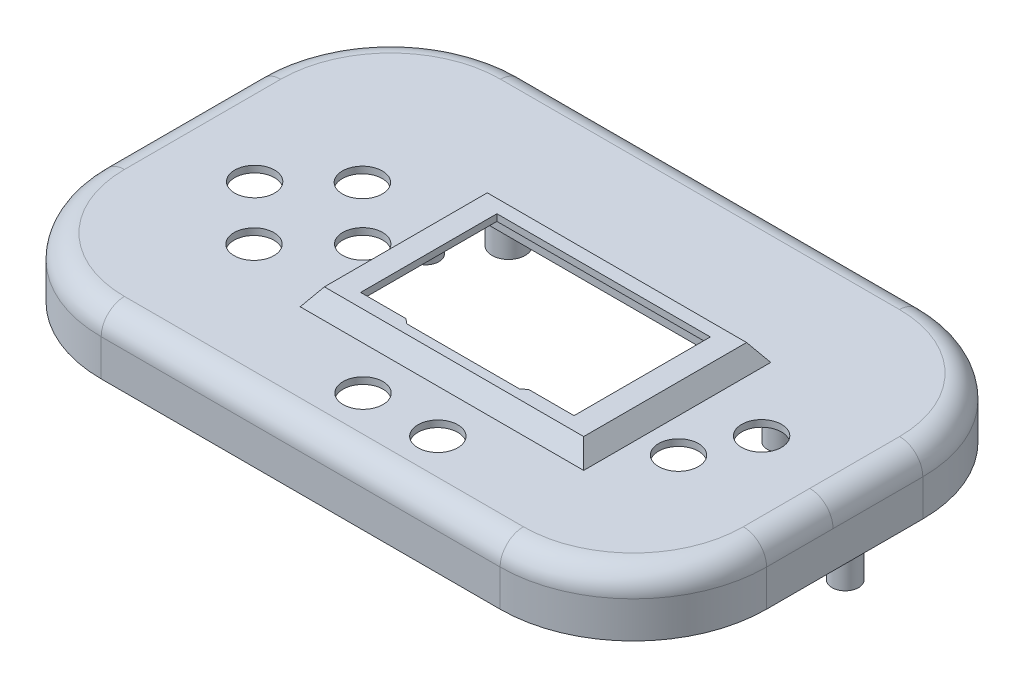
from build123d import *

# Parameters (mm, degrees)
SKETCH1_W           = 160
SKETCH1_H           = 117
BOSS_EXTRUDE1_DEPTH = 2
SKETCH3_R           = 6
CUT_EXTRUDE1_DEPTH  = 100.127443223
SKETCH4_R           = 6
CUT_EXTRUDE3_DEPTH  = 100.127443223
SKETCH5_R           = 6
CUT_EXTRUDE4_DEPTH  = 100.127443223
SKETCH6_W           = 76.000007526
SKETCH6_H           = 46.999987397
SKETCH6_W_2         = 72.000007526
SKETCH6_H_2         = 42.999987397
CUT_EXTRUDE5_DEPTH  = 10
SKETCH7_R           = 4
SKETCH7_R_2         = 1.25
BOSS_EXTRUDE2_DEPTH = 7.81
SKETCH8_W           = 78.000007526
SKETCH8_H           = 48.999987397
SKETCH8_W_2         = 76.000007526
SKETCH8_H_2         = 46.999987397
BOSS_EXTRUDE3_DEPTH = 5.19
SKETCH9_W           = 76.000007526
SKETCH9_H           = 46.999987397
BOSS_EXTRUDE4_DEPTH = 2
DRAFT2_ANGLE        = 35
SKETCH12_W          = 160
SKETCH12_H          = 14.938358446
SKETCH12_W_2        = 31.199462864
SKETCH12_H_2        = 9.099678356
SKETCH12_W_3        = 31.607152295
SKETCH12_H_3        = 7.36210802
CUT_EXTRUDE7_DEPTH  = 10
SKETCH13_R          = 6
CUT_EXTRUDE8_DEPTH  = 10
SKETCH14_W          = 120
SKETCH14_H          = 2
SKETCH14_W_2        = 2
SKETCH14_H_2        = 47
SKETCH14_H_3        = 27
SKETCH14_H_4        = 20
BOSS_EXTRUDE5_DEPTH = 8
SKETCH15_R          = 5
SKETCH15_R_2        = 4
BOSS_EXTRUDE6_DEPTH = 33.22
CHAMFER1_SIZE       = 5
SKETCH16_R          = 1.25
CUT_EXTRUDE9_DEPTH  = 10


with BuildPart() as part:
    # Sketch1 → Boss-Extrude1 (new body)
    with BuildSketch(Plane(origin=(0, 0, 0), x_dir=(1, 0, 0), z_dir=(0, 1, 0))):
        Rectangle(SKETCH1_W, SKETCH1_H)
    extrude(amount=BOSS_EXTRUDE1_DEPTH)

    # Sketch3 → Cut-Extrude1 (cut, through all)
    with BuildSketch(Plane(origin=(0, 2, 0), x_dir=(1, 0, 0), z_dir=(0, 1, 0))):
        with Locations(Location((72.15303621, -2.066282122, 0), (0, 0, 270))):
            Circle(SKETCH3_R)
    extrude(amount=-CUT_EXTRUDE1_DEPTH, mode=Mode.SUBTRACT)

    # Sketch4 → Cut-Extrude3 (cut, through all)
    with BuildSketch(Plane(origin=(0, 2, 0), x_dir=(1, 0, 0), z_dir=(0, 1, 0))):
        with Locations(Location((23.553035896, -50.866150132, 0), (0, 0, 270))):
            Circle(SKETCH4_R)
    extrude(amount=-CUT_EXTRUDE3_DEPTH, mode=Mode.SUBTRACT)

    # Sketch5 → Cut-Extrude4 (cut, through all)
    with BuildSketch(Plane(origin=(0, 2, 0), x_dir=(1, 0, 0), z_dir=(0, 1, 0))):
        with Locations(Location((64.653036213, -19.566282124, 0), (0, 0, 270))):
            Circle(SKETCH5_R)
        with Locations(Location((-37.846967603, -12.066282143, 0), (0, 0, 270))):
            Circle(SKETCH5_R)
        with Locations(Location((1.053035896, -50.866150137, 0), (0, 0, 270))):
            Circle(SKETCH5_R)
        with Locations(Location((-53.91492316, 3.900994062, 0), (0, 0, 270))):
            Circle(SKETCH5_R)
        with Locations(Location((-70.34696951, -12.066282149, 0), (0, 0, 270))):
            Circle(SKETCH5_R)
        with Locations(Location((-54.14683932, -28.466289977, 0), (0, 0, 270))):
            Circle(SKETCH5_R)
    extrude(amount=-CUT_EXTRUDE4_DEPTH, mode=Mode.SUBTRACT)

    # Sketch6 → Cut-Extrude5 (cut)
    with BuildSketch(Plane(origin=(0, 2, 0), x_dir=(1, 0, 0), z_dir=(0, 1, 0))):
        with Locations((11.764130909, -9.702217308)):
            Rectangle(SKETCH6_W, SKETCH6_H)
        with Locations((11.764130909, -9.702217308)):
            Rectangle(SKETCH6_W_2, SKETCH6_H_2, mode=Mode.SUBTRACT)
    extrude(amount=-CUT_EXTRUDE5_DEPTH, mode=Mode.SUBTRACT)


with BuildPart() as cut_extrude5_kept_piece:
    # of the separate pieces the step leaves, the one the design keeps (cut_extrude5_pieces_kept)
    add(part.part.solids().sort_by_distance((80, 0, 58.5))[0])

    # Sketch7 → Boss-Extrude2 (add)
    # profile 1 of 5: a face of its own
    with BuildSketch(Plane.XZ):
        with Locations(Location((66.701777656, -9.076203809, 0), (0, 0, 90))):
            Circle(SKETCH7_R)
        with Locations(Location((66.701777656, -9.076203809, 0), (0, 0, 270))):
            Circle(SKETCH7_R_2, mode=Mode.SUBTRACT)
    # profile 2 of 5: a face of its own
    with BuildSketch(Plane.XZ):
        with Locations(Location((63.702108967, 46.190679909, 0), (0, 0, 90))):
            Circle(SKETCH7_R)
        with Locations(Location((63.702108967, 46.190679909, 0), (0, 0, 270))):
            Circle(SKETCH7_R_2, mode=Mode.SUBTRACT)
    # profile 3 of 5: a face of its own
    with BuildSketch(Plane.XZ):
        with Locations(Location((-31.54560253, 48.927228564, 0), (0, 0, 90))):
            Circle(SKETCH7_R)
        with Locations(Location((-31.54560253, 48.927228564, 0), (0, 0, 270))):
            Circle(SKETCH7_R_2, mode=Mode.SUBTRACT)
    # profile 4 of 5: a face of its own
    with BuildSketch(Plane.XZ):
        with Locations(Location((-70.794006102, 29.915173129, 0), (0, 0, 90))):
            Circle(SKETCH7_R)
        with Locations(Location((-70.794006102, 29.915173129, 0), (0, 0, 270))):
            Circle(SKETCH7_R_2, mode=Mode.SUBTRACT)
    # profile 5 of 5: a face of its own
    with BuildSketch(Plane.XZ):
        with Locations(Location((-35.552994644, -4.584596423, 0), (0, 0, 90))):
            Circle(SKETCH7_R)
        with Locations(Location((-35.552994644, -4.584596423, 0), (0, 0, 270))):
            Circle(SKETCH7_R_2, mode=Mode.SUBTRACT)
    extrude(amount=BOSS_EXTRUDE2_DEPTH)

    # Sketch8 → Boss-Extrude3 (add)
    with BuildSketch(Plane(origin=(0, 2, 0), x_dir=(1, 0, 0), z_dir=(0, 1, 0))):
        with Locations((11.764130909, -9.702217308)):
            Rectangle(SKETCH8_W, SKETCH8_H)
        with Locations((11.764130909, -9.702217308)):
            Rectangle(SKETCH8_W_2, SKETCH8_H_2, mode=Mode.SUBTRACT)
    extrude(amount=BOSS_EXTRUDE3_DEPTH)

    # Sketch9 → Boss-Extrude4 (add)
    with BuildSketch(Plane(origin=(0, 7.19, 0), x_dir=(1, 0, 0), z_dir=(0, 1, 0))):
        with Locations((11.764130909, -9.702217308)):
            Rectangle(SKETCH9_W, SKETCH9_H)
        Polygon((-5.195084148, -31.43953726), (-6.695094805, -30.202211996), (-20.335872635, -30.202211996), (-20.335872635, 10.797777117), (43.864134191, 10.797777117), (43.864134191, -30.202211996), (30.223355703, -30.202211996), (28.723346116, -31.43953726), align=None, mode=Mode.SUBTRACT)
    extrude(amount=-BOSS_EXTRUDE4_DEPTH)

    # Draft2
    draft2_faces = [cut_extrude5_kept_piece.faces().sort_by_distance(p)[0] for p in [
        (11.764130909, 4.595, -14.79777639),
        (-27.235872854, 4.595, 9.702217309),
        (11.764130909, 4.595, 34.202211007),
        (50.764134672, 4.595, 9.702217309),
    ]]
    draft(draft2_faces, Plane.ZX.offset(7.19), DRAFT2_ANGLE)

    # Sketch12 → Cut-Extrude7 (cut)
    with BuildSketch(Plane(origin=(0, 2, 0), x_dir=(1, 0, 0), z_dir=(0, 1, 0))):
        with Locations((0, 51.030820777)):
            Rectangle(SKETCH12_W, SKETCH12_H)
        with Locations((-64.400268568, -53.950160822)):
            Rectangle(SKETCH12_W_2, SKETCH12_H_2)
        with Locations((64.196423853, -54.81894599)):
            Rectangle(SKETCH12_W_3, SKETCH12_H_3)
    extrude(amount=-CUT_EXTRUDE7_DEPTH, mode=Mode.SUBTRACT)

    # Sweep1: sweep along a path in Sketch10
    with BuildLine(Plane(origin=(0, 2, 0), x_dir=(1, 0, 0), z_dir=(0, 1, 0))) as sweep1_path:
        Line((-60, 58.5), (60, 58.5))
        ThreePointArc((60, 58.5), (88.284271247, 46.784271247), (100, 18.5))
        Line((100, 18.5), (100, -28.5))
        ThreePointArc((100, -28.5), (88.284271247, -56.784271247), (60, -68.5))
        Line((60, -68.5), (-60, -68.5))
        ThreePointArc((-60, -68.5), (-88.284271247, -56.784271247), (-100, -28.5))
        Line((-100, -28.5), (-100, 18.5))
        ThreePointArc((-100, 18.5), (-88.284271247, 46.784271247), (-60, 58.5))
    # Sketch11 → Sweep1 (sweep)
    with BuildSketch(Plane.XY.offset(8.5)):
        with BuildLine():
            Line((80, 2), (93.077362885, 2))
            ThreePointArc((93.077362885, 2), (98.027110354, -0.050252532), (100.077362885, -5))
            Line((100.077362885, -5), (100.077362885, -7.985538351))
            Line((100.077362885, -7.985538351), (98.077362885, -7.985538351))
            Line((98.077362885, -7.985538351), (98.077362885, -7))
            ThreePointArc((98.077362885, -7), (96.027110354, -2.050252532), (91.077362885, 0))
            Line((91.077362885, 0), (80, 0))
            Line((80, 0), (80, 2))
        make_face()
    sweep(path=sweep1_path.line)

    # Sketch13 → Cut-Extrude8 (cut)
    with BuildSketch(Plane(origin=(0, 2, 0), x_dir=(1, 0, 0), z_dir=(0, 1, 0))):
        with Locations(Location((1.053035896, -50.866150137, 0), (0, 0, 270))):
            Circle(SKETCH13_R)
        with Locations(Location((23.553035896, -50.866150132, 0), (0, 0, 270))):
            Circle(SKETCH13_R)
    extrude(amount=-CUT_EXTRUDE8_DEPTH, mode=Mode.SUBTRACT)

    # Sketch14 → Boss-Extrude5 (add)
    with BuildSketch(Plane.XZ.offset(7.985538351)):
        with Locations((0, 67.577362885)):
            Rectangle(SKETCH14_W, SKETCH14_H)
        with BuildLine():
            Line((-60, 66.577362885), (-60, 68.577362885))
            ThreePointArc((-60, 68.577362885), (-88.338975068, 56.838975068), (-100.077362885, 28.5))
            Line((-100.077362885, 28.5), (-98.077362885, 28.5))
            ThreePointArc((-98.077362885, 28.5), (-86.924761506, 55.424761506), (-60, 66.577362885))
        make_face()
        with Locations((-99.077362885, 5)):
            Rectangle(SKETCH14_W_2, SKETCH14_H_2)
        with BuildLine():
            ThreePointArc((-98.077362885, -18.5), (-86.924761506, -45.424761506), (-60, -56.577362885))
            Line((-60, -56.577362885), (-60, -58.577362885))
            ThreePointArc((-60, -58.577362885), (-88.338975068, -46.838975068), (-100.077362885, -18.5))
            Line((-100.077362885, -18.5), (-98.077362885, -18.5))
        make_face()
        with Locations((0, -57.577362885)):
            Rectangle(SKETCH14_W, SKETCH14_H)
        with BuildLine():
            ThreePointArc((60, -56.577362885), (86.924761506, -45.424761506), (98.077362885, -18.5))
            Line((98.077362885, -18.5), (100.077362885, -18.5))
            ThreePointArc((100.077362885, -18.5), (88.338975068, -46.838975068), (60, -58.577362885))
            Line((60, -58.577362885), (60, -56.577362885))
        make_face()
        with Locations((99.077362885, -5)):
            Rectangle(SKETCH14_W_2, SKETCH14_H_3)
        with Locations((99.077362885, 18.5)):
            Rectangle(SKETCH14_W_2, SKETCH14_H_4)
        with BuildLine():
            ThreePointArc((98.077362885, 28.5), (86.924761506, 55.424761506), (60, 66.577362885))
            Line((60, 66.577362885), (60, 68.577362885))
            ThreePointArc((60, 68.577362885), (88.338975068, 56.838975068), (100.077362885, 28.5))
            Line((100.077362885, 28.5), (98.077362885, 28.5))
        make_face()
    extrude(amount=BOSS_EXTRUDE5_DEPTH)

    # Sketch15 → Boss-Extrude6 (add)
    with BuildSketch(Plane.XZ):
        with Locations(Location((-50.604326003, -44.577362885, 0), (0, 0, 270))):
            Circle(SKETCH15_R)
        with Locations((87.077362885, -8.173505589)):
            Circle(SKETCH15_R_2)
    extrude(amount=BOSS_EXTRUDE6_DEPTH)

    # Chamfer1
    # the kernel refuses this chamfer: 5 mm, written as the material it adds along each edge
    with BuildSketch(Plane(origin=(-50.604326003, 0, -44.577362885), x_dir=(0, 0, -1), z_dir=(-1, 0, 0))) as chamfer1_piece_1:
        Polygon((5 + CHAMFER1_SIZE, 0), (5, CHAMFER1_SIZE), (5, 0), align=None)
    revolve(axis=Axis((-50.604326003, 0, -44.577362885), (0, -1, 0)))
    with BuildSketch(Plane(origin=(87.077362885, 0, -8.173505589), x_dir=(1, 0, 0), z_dir=(0, 0, -1))) as chamfer1_piece_2:
        Polygon((4 + CHAMFER1_SIZE, 0), (4, CHAMFER1_SIZE), (4, 0), align=None)
    revolve(axis=Axis((87.077362885, 0, -8.173505589), (0, -1, 0)))

    # Sketch16 → Cut-Extrude9 (cut)
    with BuildSketch(Plane.XZ.offset(33.22)):
        with Locations(Location((-50.604326003, -44.577362885, 0), (0, 0, 270))):
            Circle(SKETCH16_R)
        with Locations(Location((87.077362885, -8.173505589, 0), (0, 0, 270))):
            Circle(SKETCH16_R)
    extrude(amount=-CUT_EXTRUDE9_DEPTH, mode=Mode.SUBTRACT)


solid = cut_extrude5_kept_piece.part
